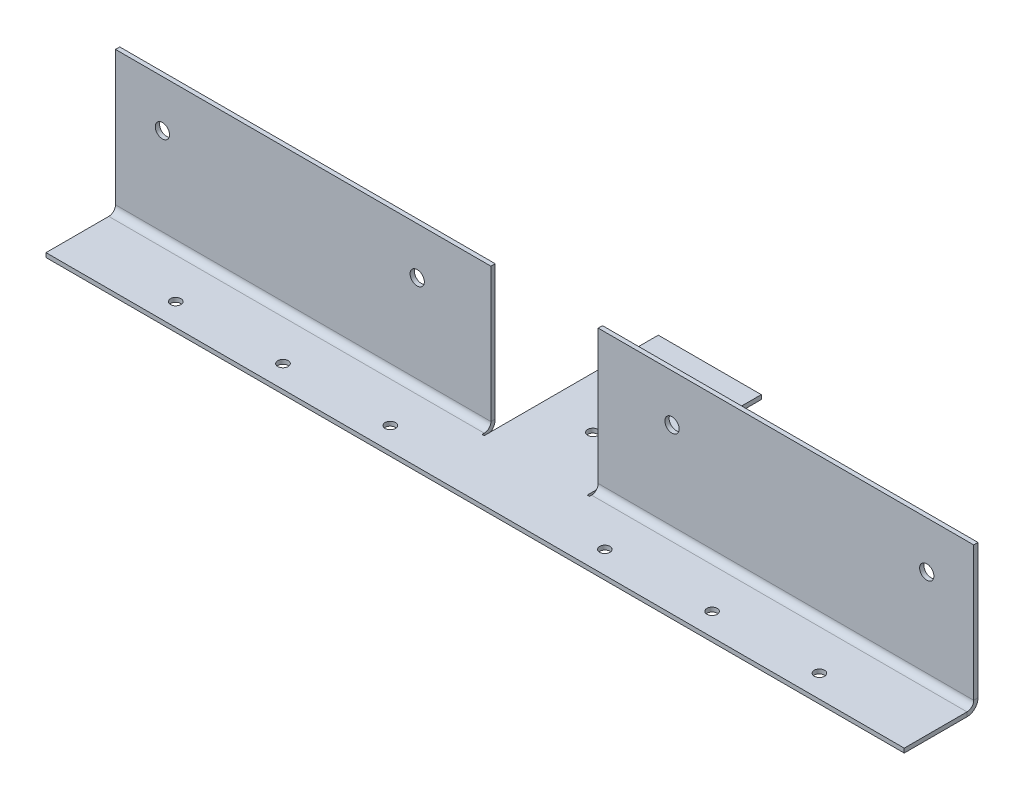
from build123d import *

# Parameters (mm, degrees)
SKETCH1_W                    = 406.4
SKETCH1_H                    = 111.125
BASE_FLANGE1_DEPTH           = 2.032
EDGE_FLANGE2_START           = -203.2
EDGE_FLANGE2_DEPTH           = 178.816
EDGE_FLANGE2_START_2         = -25.4
EDGE_FLANGE2_2_DEPTH         = 1.016
EDGE_FLANGE2_3_DEPTH         = 177.8
EDGE_FLANGE3_START           = 24.384
EDGE_FLANGE3_DEPTH           = 178.816
EDGE_FLANGE3_2_DEPTH         = 1.016
EDGE_FLANGE3_START_2         = 25.4
EDGE_FLANGE3_3_DEPTH         = 177.8
SKETCH24_W                   = 177.8
SKETCH24_H                   = 2.032
BOSS_EXTRUDE1_DEPTH          = 5.4229
F_10_0_1935_DIAMETER_HOLE1_D = 4.9149
F_1_4_CLEARANCE_HOLE1_D      = 6.7564


# Read off the part's stored shape, not the designer's step: Edge-Flange2, Edge-Flange3
# Sheet-metal steps are written as plain solids
with BuildPart() as part:
    # Sketch1 → Base-Flange1 (new body)
    with BuildSketch(Plane(origin=(0, 0, 0), x_dir=(1, 0, 0), z_dir=(0, 1, 0))):
        with Locations((0, 55.5625)):
            Rectangle(SKETCH1_W, SKETCH1_H)
    extrude(amount=-BASE_FLANGE1_DEPTH)

    # Edge-Flange2 outline → Edge-Flange2 (cut)
    with BuildSketch(Plane.YZ.offset(EDGE_FLANGE2_START)):
        with BuildLine():
            ThreePointArc((0, -33.84501151), (-1.496459836, -32.018067825), (-2.032, -29.718))
            Line((-2.032, -29.718), (-2.032, -111.125))
            Line((-2.032, -111.125), (0, -111.125))
            Line((0, -111.125), (0, -33.84501151))
        make_face()
    extrude(amount=EDGE_FLANGE2_DEPTH, mode=Mode.SUBTRACT)

    # Edge-Flange2 2 outline → Edge-Flange2 2 (cut)
    with BuildSketch(Plane.YZ.offset(EDGE_FLANGE2_START_2)):
        with BuildLine():
            Line((0, -28.702), (-2.032, -28.702))
            Line((-2.032, -28.702), (-2.032, -29.718))
            ThreePointArc((-2.032, -29.718), (-1.496459836, -32.018067825), (0, -33.84501151))
            Line((0, -33.84501151), (0, -28.702))
        make_face()
    extrude(amount=EDGE_FLANGE2_2_DEPTH, mode=Mode.SUBTRACT)

    # Edge-Flange2 3 outline → Edge-Flange2 3 (add)
    with BuildSketch(Plane.YZ.offset(EDGE_FLANGE2_START)):
        with BuildLine():
            ThreePointArc((3.175, -32.893), (0.92993597, -31.96306403), (0, -29.718))
            Line((0, -29.718), (0, -33.84501151))
            ThreePointArc((0, -33.84501151), (1.498172628, -34.647614485), (3.175, -34.925))
            Line((3.175, -34.925), (61.468, -34.925))
            Line((61.468, -34.925), (61.468, -32.893))
            Line((61.468, -32.893), (3.175, -32.893))
        make_face()
    extrude(amount=EDGE_FLANGE2_3_DEPTH)

    # Edge-Flange3 outline → Edge-Flange3 (cut)
    with BuildSketch(Plane.YZ.offset(EDGE_FLANGE3_START)):
        with BuildLine():
            ThreePointArc((0, -33.84501151), (-1.496459836, -32.018067825), (-2.032, -29.718))
            Line((-2.032, -29.718), (-2.032, -111.125))
            Line((-2.032, -111.125), (0, -111.125))
            Line((0, -111.125), (0, -33.84501151))
        make_face()
    extrude(amount=EDGE_FLANGE3_DEPTH, mode=Mode.SUBTRACT)

    # Edge-Flange3 2 outline → Edge-Flange3 2 (cut)
    with BuildSketch(Plane.YZ.offset(EDGE_FLANGE3_START)):
        with BuildLine():
            Line((0, -28.702), (-2.032, -28.702))
            Line((-2.032, -28.702), (-2.032, -29.718))
            ThreePointArc((-2.032, -29.718), (-1.496459836, -32.018067825), (0, -33.84501151))
            Line((0, -33.84501151), (0, -28.702))
        make_face()
    extrude(amount=EDGE_FLANGE3_2_DEPTH, mode=Mode.SUBTRACT)

    # Edge-Flange3 3 outline → Edge-Flange3 3 (add)
    with BuildSketch(Plane.YZ.offset(EDGE_FLANGE3_START_2)):
        with BuildLine():
            ThreePointArc((3.175, -32.893), (0.92993597, -31.96306403), (0, -29.718))
            Line((0, -29.718), (0, -33.84501151))
            ThreePointArc((0, -33.84501151), (1.498172628, -34.647614485), (3.175, -34.925))
            Line((3.175, -34.925), (61.468, -34.925))
            Line((61.468, -34.925), (61.468, -32.893))
            Line((61.468, -32.893), (3.175, -32.893))
        make_face()
    extrude(amount=EDGE_FLANGE3_3_DEPTH)

    # Sketch24 → Boss-Extrude1 (add)
    with BuildSketch(Plane(origin=(0, 61.468, 0), x_dir=(1, 0, 0), z_dir=(0, 1, 0))):
        with Locations((-114.3, 33.909)):
            Rectangle(SKETCH24_W, SKETCH24_H)
        with Locations((114.3, 33.909)):
            Rectangle(SKETCH24_W, SKETCH24_H)
    extrude(amount=BOSS_EXTRUDE1_DEPTH)

    # #10 (0.1935) Diameter Hole1 (through all)
    with Locations(Plane(origin=(0, 0, 0), x_dir=(1, 0, 0), z_dir=(0, 1, 0))):
        with Locations((0, 93.853), (0, 55.753), (-152.4, 10.6172), (-50.8, 10.6172), (152.4, 10.6172), (50.8, 10.6172), (101.6, 10.6172), (-101.6, 10.6172)):
            Hole(F_10_0_1935_DIAMETER_HOLE1_D / 2)

    # 1/4 Clearance Hole1 (through all)
    with Locations(Plane(origin=(0, 0, -34.925), x_dir=(-1, 0, 0), z_dir=(0, 0, -1))):
        with Locations((180.975, 44.6659), (60.325, 44.6659), (-180.975, 44.6659), (-60.325, 44.6659)):
            Hole(F_1_4_CLEARANCE_HOLE1_D / 2)


solid = part.part
